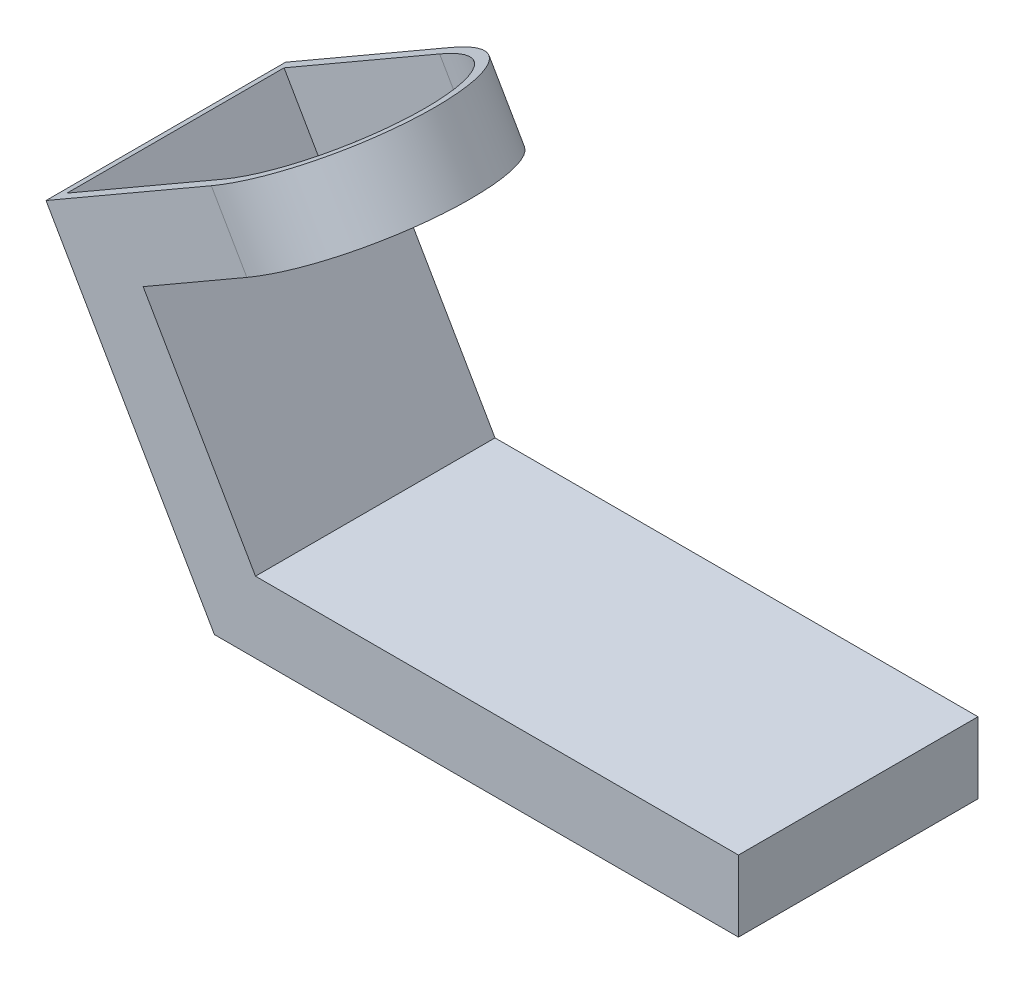
from build123d import *

# Parameters (mm, degrees)
BOSS_EXTRU_1_DEPTH      = 64
BOSS_EXTRU_2_DEPTH      = 19
ENL_V_MAT_EXTRU_1_REACH = 212.704
ESQUISSE3_R             = 9.500000000000002
COQUE1_T                = -3


with BuildPart() as part:
    # Esquisse1 → Boss.-Extru.1 (new body)
    with BuildSketch(Plane.XY):
        Polygon((0, 0), (-44.99999999999982, 77.94228634059958), (-0.8327044069934009, 103.44228634059948), (8.667295593006552, 86.98780366869514), (-19.0455173280955, 70.9878036686952), (10.969655114602942, 19), (140.00000000000003, 19), (140.00000000000003, 0), align=None)
    extrude(amount=-BOSS_EXTRU_1_DEPTH)

    # Esquisse2 → Boss.-Extru.2 (add)
    with BuildSketch(Plane(origin=(-44.99999999999984, 77.94228634059961, 0), x_dir=(0.8660254037844398, 0.49999999999999806, 0), z_dir=(-0.499999999999998, 0.8660254037844397, 0))):
        with BuildLine():
            Line((50.999999999999986, 64), (50.99999999999999, 0))
            ThreePointArc((50.99999999999999, 0), (82.99999999999999, 32), (50.999999999999986, 64))
        make_face()
    extrude(amount=-BOSS_EXTRU_2_DEPTH)

    # Esquisse3 → Enlèv. mat.-Extru.1 (cut, up to next)
    with BuildSketch(Plane(origin=(-44.99999999999984, 77.94228634059961, 0), x_dir=(0.8660254037844398, 0.49999999999999806, 0), z_dir=(-0.499999999999998, 0.8660254037844397, 0)), mode=Mode.PRIVATE) as enl_v_mat_extru_1_sk1:
        with Locations((50.99999999999997, 32)):
            Circle(ESQUISSE3_R)
    enl_v_mat_extru_1_tool1 = extrude(enl_v_mat_extru_1_sk1.sketch, amount=-ENL_V_MAT_EXTRU_1_REACH, mode=Mode.PRIVATE) & part.part
    add(enl_v_mat_extru_1_tool1.solids().sort_by_distance((-0.832704, 103.442286, -32))[0], mode=Mode.SUBTRACT)

    # Coque1
    coque1_openings = [part.faces().sort_by_distance(p)[0] for p in [
        (-12.417537386, 96.753779901, -32),
        (-4.309945743, 90.465045005, -32),
    ]]
    offset(amount=COQUE1_T, openings=coque1_openings, kind=Kind.INTERSECTION)


solid = part.part
